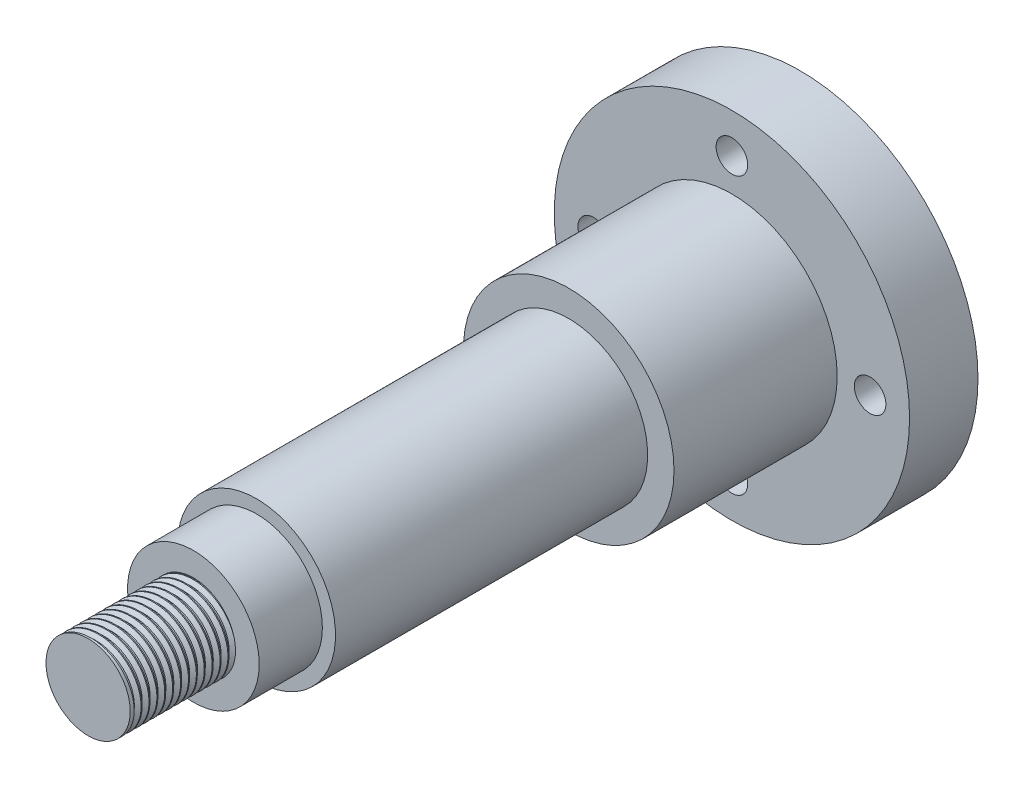
from build123d import *

# Parameters (mm, degrees)
BOSS_EXTRUDE1_DEPTH      = 10
BOSS_EXTRUDE1_DEPTH_BACK = 3
SKETCH3_R                = 33.75
SKETCH4_R                = 20
BOSS_EXTRUDE2_DEPTH      = 31
SKETCH5_R                = 15
BOSS_EXTRUDE3_DEPTH      = 59.3
SKETCH6_R                = 12.5
BOSS_EXTRUDE4_DEPTH      = 12
SKETCH7_R                = 3
CUT_EXTRUDE1_DEPTH       = 40
SKETCH8_R                = 8
BOSS_EXTRUDE5_DEPTH      = 20
THREAD1_PITCH            = 1.5


with BuildPart() as part:
    # Sketch3 → Boss-Extrude1 (new, two sides: drawn at the far end of the back side and taken through both)
    with BuildSketch(Plane.XY.offset(-BOSS_EXTRUDE1_DEPTH_BACK)):
        Circle(SKETCH3_R)
    extrude(amount=BOSS_EXTRUDE1_DEPTH + BOSS_EXTRUDE1_DEPTH_BACK)

    # Sketch4 → Boss-Extrude2 (add)
    with BuildSketch(Plane.XY.offset(10)):
        Circle(SKETCH4_R)
    extrude(amount=BOSS_EXTRUDE2_DEPTH)

    # Sketch5 → Boss-Extrude3 (add)
    with BuildSketch(Plane.XY.offset(41)):
        with Locations(Location((0, 0, 0), (0, 0, 180))):
            Circle(SKETCH5_R)
    extrude(amount=BOSS_EXTRUDE3_DEPTH)

    # Sketch6 → Boss-Extrude4 (add)
    with BuildSketch(Plane.XY.offset(100.3)):
        Circle(SKETCH6_R)
    extrude(amount=BOSS_EXTRUDE4_DEPTH)

    # Sketch7 → Cut-Extrude1 (cut)
    with BuildSketch(Plane.XY.offset(10)):
        with Locations((0, 26.25)):
            Circle(SKETCH7_R)
        with Locations((26.25, 0)):
            Circle(SKETCH7_R)
        with Locations((0, -26.25)):
            Circle(SKETCH7_R)
        with Locations((-26.25, 0)):
            Circle(SKETCH7_R)
    extrude(amount=-CUT_EXTRUDE1_DEPTH, mode=Mode.SUBTRACT)

    # Sketch8 → Boss-Extrude5 (add)
    with BuildSketch(Plane.XY.offset(112.3)):
        Circle(SKETCH8_R)
    extrude(amount=BOSS_EXTRUDE5_DEPTH)

    # Thread1: the profile of Thread Profile1 profile screwed along a right-hand helix of 13.333333 turns, 8 arcs to a turn; built about Z, then put on its axis
    thread1_z = Axis((0, 0, 0), (0, 0, 1))
    thread1_corners = [(8.0003, 0, -0.000173205), (8.0003, 0, 1.312673201), (7.188101188, 0, 0.843749998), (7.188101188, 0, 0.468749998)]
    with BuildLine(mode=Mode.PRIVATE) as thread1_profile:
        Line(thread1_corners[0], thread1_corners[1])
        Line(thread1_corners[1], thread1_corners[2])
        Line(thread1_corners[2], thread1_corners[3])
        Line(thread1_corners[3], thread1_corners[0])
    thread1_cap = Face(thread1_profile.wire())
    thread1_turn_angles = [0, 22.5, 45, 67.5, 90, 112.5, 135, 157.5, 180, 202.5, 225, 247.5, 270, 292.5, 315, 337.5, 360]
    thread1_turn_weights = [1, 0.9238795325112867, 1, 0.9238795325112867, 1, 0.9238795325112867, 1, 0.9238795325112867, 1, 0.9238795325112867, 1, 0.9238795325112867, 1, 0.9238795325112867, 1, 0.9238795325112867, 1]
    thread1_turn_rails = [Edge.make_bspline([Vector(p[0], p[1], 0).rotate(thread1_z, thread1_turn_angles[k]) / thread1_turn_weights[k] + Vector(0, 0, p[2] + THREAD1_PITCH * thread1_turn_angles[k] / 360) for k in range(17)], [0, 0, 0, 1, 1, 2, 2, 3, 3, 4, 4, 5, 5, 6, 6, 7, 7, 8, 8, 8], 2, thread1_turn_weights) for p in thread1_corners]
    thread1_turn_sides = [Face.make_surface_from_curves(thread1_turn_rails[p[0]], thread1_turn_rails[p[1]]) for p in [(0, 1), (1, 2), (2, 3), (3, 0)]]
    thread1_last_angles = [4680, 4702.5, 4725, 4747.5, 4770, 4785, 4800]
    thread1_last_weights = [1, 0.9238795325112867, 1, 0.9238795325112867, 1, 0.9659258262890703, 1]
    thread1_last_rails = [Edge.make_bspline([Vector(p[0], p[1], 0).rotate(thread1_z, thread1_last_angles[k]) / thread1_last_weights[k] + Vector(0, 0, p[2] + THREAD1_PITCH * thread1_last_angles[k] / 360) for k in range(7)], [0, 0, 0, 1, 1, 2, 2, 3, 3, 3], 2, thread1_last_weights) for p in thread1_corners]
    thread1_last_sides = [Face.make_surface_from_curves(thread1_last_rails[p[0]], thread1_last_rails[p[1]]) for p in [(0, 1), (1, 2), (2, 3), (3, 0)]]
    thread1 = Plane(origin=(0, 0, 132.3), x_dir=(-1, 0, 0), z_dir=(0, 0, -1)) * Solid(Shell([*[p.moved(Location((0, 0, THREAD1_PITCH * i))) for i in range(13) for p in thread1_turn_sides], *thread1_last_sides, thread1_cap, thread1_cap.rotate(thread1_z, 4800).moved(Location((0, 0, THREAD1_PITCH * 4800 / 360)))]))
    add(thread1, mode=Mode.SUBTRACT)


solid = part.part
